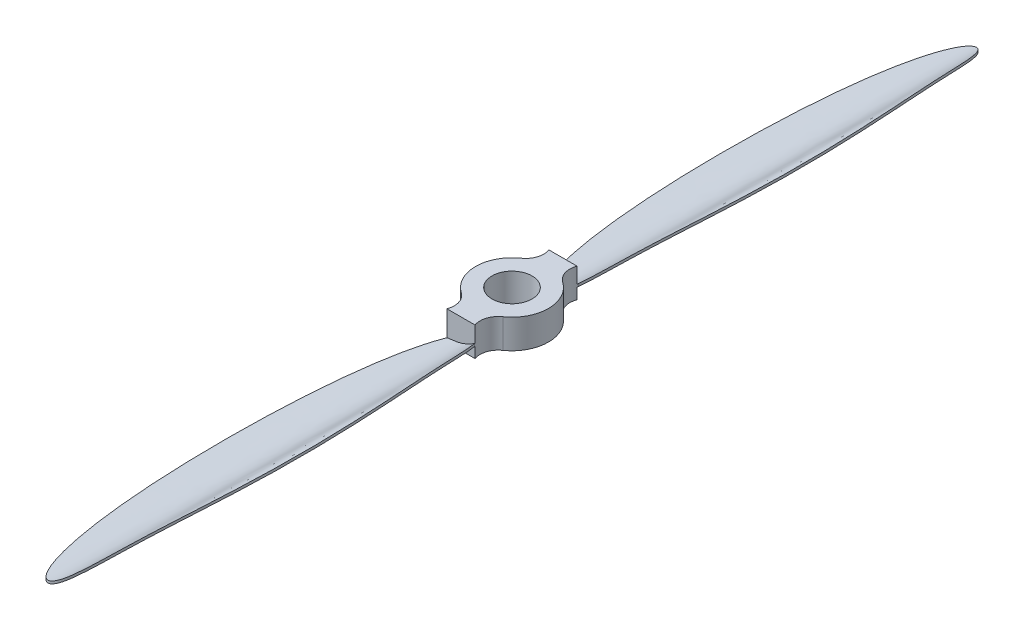
from build123d import *
from OCP.BRepAlgoAPI import BRepAlgoAPI_Cut
from OCP.TopTools import TopTools_ListOfShape

# Parameters (mm, degrees)
CROQUIS1_R              = 5.5
SALIENTE_EXTRUIR1_DEPTH = 8
CORTAR_EXTRUIR1_DEPTH   = 113
CORTAR_EXTRUIR2_DEPTH   = 113


with BuildPart() as part:
    # Croquis1 → Saliente-Extruir1 (new body)
    with BuildSketch(Plane(origin=(0, 0, 0), x_dir=(1, 0, 0), z_dir=(0, 1, 0))):
        with BuildLine():
            ThreePointArc((-5.705045295, 8.21294455), (-10, 0), (-5.705045295, -8.21294455))
            ThreePointArc((-5.705045295, -8.21294455), (-3.744086953, -10.966493778), (-3.983349779, -14.338458231))
            add(Edge.make_bspline(
                [(-3.983349779, -14.338458231), (-16.746209804, -43.253222424), (-8.373104902, -104.032809261), (0, -164.812396098), (8.373104902, -104.032809261), (16.746209804, -43.253222424), (3.983349779, -14.338458231)],
                knots=[3.529141129, 3.529141129, 3.529141129, 5.365170581, 5.365170581, 7.201200033, 7.201200033, 9.037229485, 9.037229485, 9.037229485], degree=2, weights=[1, 0.607398449, 1, 0.607398449, 1, 0.607398449, 1]))
            ThreePointArc((3.983349779, -14.338458231), (3.744086953, -10.966493778), (5.705045295, -8.21294455))
            ThreePointArc((5.705045295, -8.21294455), (10, 0), (5.705045295, 8.21294455))
            ThreePointArc((5.705045295, 8.21294455), (3.744086953, 10.966493778), (3.983349779, 14.338458231))
            add(Edge.make_bspline(
                [(3.983349779, 14.338458231), (16.746209804, 43.253222424), (8.373104902, 104.032809261), (0, 164.812396098), (-8.373104902, 104.032809261), (-16.746209804, 43.253222424), (-3.983349779, 14.338458231)],
                knots=[3.529141129, 3.529141129, 3.529141129, 5.365170581, 5.365170581, 7.201200033, 7.201200033, 9.037229485, 9.037229485, 9.037229485], degree=2, weights=[1, 0.607398449, 1, 0.607398449, 1, 0.607398449, 1]))
            ThreePointArc((-3.983349779, 14.338458231), (-3.744086953, 10.966493778), (-5.705045295, 8.21294455))
        make_face()
        Circle(CROQUIS1_R, mode=Mode.SUBTRACT)
    extrude(amount=SALIENTE_EXTRUIR1_DEPTH)


with BuildPart() as cortar_extruir1_tool:
    # Croquis2 → Cortar-Extruir1 (new body)
    with BuildSketch(Plane.XY.offset(127)):
        with BuildLine():
            add(Edge.make_bspline(
                [(-10.540197636, 0), (-6.603539772, 0.46478874), (0.424988199, -0.221526612), (6.236212827, 4.945174416), (8.914111447, 7.197478074), (10.540197636, 7.3)],
                knots=[0, 0, 0, 0, 0.556269346, 0.795858616, 1, 1, 1, 1], degree=3))
            Line((-10.540197636, 0), (10.540197636, 0))
            Line((10.540197636, 0), (10.540197636, 7.3))
        make_face()
        with BuildLine():
            Line((-10.540197636, 8), (-10.540197636, 0.7))
            add(Edge.make_bspline(
                [(-10.540197636, 0.7), (-6.603539772, 1.16478874), (0.424988199, 0.478473388), (6.236212827, 5.645174416), (8.914111447, 7.897478074), (10.540197636, 8)],
                knots=[0, 0, 0, 0, 0.556269346, 0.795858616, 1, 1, 1, 1], degree=3))
            Line((10.540197636, 8), (-10.540197636, 8))
        make_face()
    extrude(amount=-CORTAR_EXTRUIR1_DEPTH)


with BuildPart() as part_1:
    add(part.part)

    # Cortar-Extruir1: cut by cortar_extruir1_tool, with a tolerance
    cortar_extruir1_stock = TopTools_ListOfShape()
    cortar_extruir1_stock.Append(part_1.part.wrapped)
    cortar_extruir1_tools = TopTools_ListOfShape()
    cortar_extruir1_tools.Append(cortar_extruir1_tool.part.wrapped)
    cortar_extruir1_cut = BRepAlgoAPI_Cut()
    cortar_extruir1_cut.SetArguments(cortar_extruir1_stock)
    cortar_extruir1_cut.SetTools(cortar_extruir1_tools)
    cortar_extruir1_cut.SetFuzzyValue(0.00001)
    cortar_extruir1_cut.Build()
    add(Compound.cast(cortar_extruir1_cut.Shape()).solids(), mode=Mode.REPLACE)


with BuildPart() as cortar_extruir2_tool:
    # Croquis3 → Cortar-Extruir2 (new body)
    with BuildSketch(Plane(origin=(0, 0, -127), x_dir=(-1, 0, 0), z_dir=(0, 0, -1))):
        with BuildLine():
            Line((-10.540197636, 7.3), (-10.540197636, 0))
            Line((-10.540197636, 0), (10.540197636, 0))
            add(Edge.make_bspline(
                [(10.540197636, 0), (6.603539772, 0.46478874), (-0.424988199, -0.221526612), (-6.236212827, 4.945174416), (-8.914111447, 7.197478074), (-10.540197636, 7.3)],
                knots=[0, 0, 0, 0, 0.556269346, 0.795858616, 1, 1, 1, 1], degree=3))
        make_face()
        with BuildLine():
            add(Edge.make_bspline(
                [(10.540197636, 0.7), (6.603539772, 1.16478874), (-0.424988199, 0.478473388), (-6.236212827, 5.645174416), (-8.914111447, 7.897478074), (-10.540197636, 8)],
                knots=[0, 0, 0, 0, 0.556269346, 0.795858616, 1, 1, 1, 1], degree=3))
            Line((10.540197636, 0.7), (10.540197636, 8))
            Line((10.540197636, 8), (-10.540197636, 8))
        make_face()
    extrude(amount=-CORTAR_EXTRUIR2_DEPTH)


with BuildPart() as part_2:
    add(part_1.part)

    # Cortar-Extruir2: cut by cortar_extruir2_tool, with a tolerance
    cortar_extruir2_stock = TopTools_ListOfShape()
    cortar_extruir2_stock.Append(part_2.part.wrapped)
    cortar_extruir2_tools = TopTools_ListOfShape()
    cortar_extruir2_tools.Append(cortar_extruir2_tool.part.wrapped)
    cortar_extruir2_cut = BRepAlgoAPI_Cut()
    cortar_extruir2_cut.SetArguments(cortar_extruir2_stock)
    cortar_extruir2_cut.SetTools(cortar_extruir2_tools)
    cortar_extruir2_cut.SetFuzzyValue(0.00001)
    cortar_extruir2_cut.Build()
    add(Compound.cast(cortar_extruir2_cut.Shape()).solids(), mode=Mode.REPLACE)


solid = part_2.part
